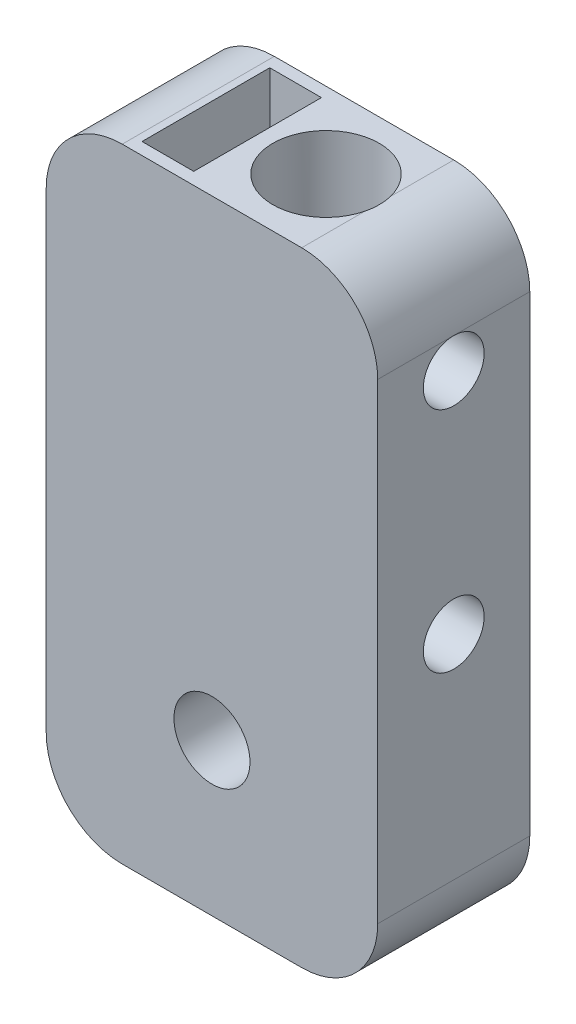
from build123d import *

# Parameters (mm, degrees)
CROQUIS1_W              = 10
CROQUIS1_H              = 41
SALIENTE_EXTRUIR1_DEPTH = 21.8
CROQUIS6_R              = 2
CORTAR_EXTRUIR2_DEPTH   = 21.8
CORTAR_EXTRUIR4_REACH   = 49.5
CROQUIS11_R             = 3.5
CROQUIS11_W             = 3.4
CROQUIS11_H             = 8.4
CORTAR_EXTRUIR5_REACH   = 49.5
CROQUIS12_R             = 2.5
REDONDEO1_R             = 5
CROQUIS13_R             = 3.5
CORTAR_EXTRUIR6_DEPTH   = 3.5
CROQUIS15_W             = 3.4
CROQUIS15_H             = 8.4
SALIENTE_EXTRUIR2_DEPTH = 13
CORTAR_EXTRUIR7_START   = -10
CROQUIS16_R             = 2.5
CORTAR_EXTRUIR7_DEPTH   = 10


with BuildPart() as part:
    # Croquis1 → Saliente-Extruir1 (new body)
    with BuildSketch(Plane(origin=(0, 0, 0), x_dir=(0, 0, -1), z_dir=(1, 0, 0))):
        with Locations((-5, -20.5)):
            Rectangle(CROQUIS1_W, CROQUIS1_H)
    extrude(amount=SALIENTE_EXTRUIR1_DEPTH)

    # Croquis6 → Cortar-Extruir2 (cut)
    with BuildSketch(Plane.ZY):
        with Locations((5, -22)):
            Circle(CROQUIS6_R)
        with Locations((5, -7)):
            Circle(CROQUIS6_R)
    extrude(amount=-CORTAR_EXTRUIR2_DEPTH, mode=Mode.SUBTRACT)

    # Croquis11 → Cortar-Extruir4 (cut, up to next)
    with BuildSketch(Plane.XZ.offset(41), mode=Mode.PRIVATE) as cortar_extruir4_sk1:
        with Locations(Location((13.4, 5, 0), (0, 0, 270))):
            Circle(CROQUIS11_R)
    cortar_extruir4_tool1 = extrude(cortar_extruir4_sk1.sketch, amount=-CORTAR_EXTRUIR4_REACH, mode=Mode.PRIVATE) & part.part
    # Croquis11 → Cortar-Extruir4 (cut, up to next)
    with BuildSketch(Plane.XZ.offset(41), mode=Mode.PRIVATE) as cortar_extruir4_sk2:
        with Locations((7.2, 5)):
            Rectangle(CROQUIS11_W, CROQUIS11_H)
    cortar_extruir4_tool2 = extrude(cortar_extruir4_sk2.sketch, amount=-CORTAR_EXTRUIR4_REACH, mode=Mode.PRIVATE) & part.part
    add(cortar_extruir4_tool1.solids().sort_by_distance((13.4, -41, 5))[0], mode=Mode.SUBTRACT)
    add(cortar_extruir4_tool2.solids().sort_by_distance((7.2, -41, 5))[0], mode=Mode.SUBTRACT)

    # Cortar-Extruir5: up to this face of the body (flat: up to its plane)
    cortar_extruir5_end = Plane(part.part.faces().sort_by_distance((10.9, -20.5, 10))[0])
    # Croquis12 → Cortar-Extruir5 (cut, up to the picked face)
    with BuildSketch(Plane(origin=(0, 0, 0), x_dir=(-1, 0, 0), z_dir=(0, 0, -1)), mode=Mode.PRIVATE) as cortar_extruir5_sk1:
        with Locations(Location((-10.9, -31, 0), (0, 0, 90))):
            Circle(CROQUIS12_R)
    cortar_extruir5_tool1 = split(extrude(cortar_extruir5_sk1.sketch, amount=-CORTAR_EXTRUIR5_REACH, mode=Mode.PRIVATE), bisect_by=cortar_extruir5_end, keep=Keep.BOTH, mode=Mode.PRIVATE)
    add(cortar_extruir5_tool1.solids().sort_by(Axis((10.9, -31, 0), (0, 0, 1)))[0], mode=Mode.SUBTRACT)

    # Redondeo1
    # the kernel refuses this fillet: 5 mm, written as the material it takes off along each edge
    with BuildSketch(Plane(origin=(21.8, -41, 22.5), x_dir=(0, 1, 0), z_dir=(0, 0, -1)), Plane(origin=(0, 0, -12.5), x_dir=(1, 0, 0), z_dir=(0, 0, 1))) as redondeo1_piece_1:
        with BuildLine():
            CenterArc((REDONDEO1_R, -REDONDEO1_R), REDONDEO1_R, 90, 90)
            Line((0, -REDONDEO1_R), (0, 0))
            Line((0, 0), (REDONDEO1_R, 0))
        make_face()
    extrude(amount=35, mode=Mode.SUBTRACT)
    with BuildSketch(Plane(origin=(21.8, 0, -12.5), x_dir=(-1, 0, 0), z_dir=(0, 0, 1)), Plane(origin=(0, -41, 22.5), x_dir=(0, 1, 0), z_dir=(0, 0, -1))) as redondeo1_piece_2:
        with BuildLine():
            CenterArc((REDONDEO1_R, REDONDEO1_R), REDONDEO1_R, 180, 90)
            Line((0, REDONDEO1_R), (0, 0))
            Line((0, 0), (REDONDEO1_R, 0))
        make_face()
    extrude(amount=35, mode=Mode.SUBTRACT)

    # Croquis13 → Cortar-Extruir6 (cut)
    with BuildSketch(Plane.ZY):
        with Locations((5, -7)):
            Circle(CROQUIS13_R)
        with Locations((5, -22)):
            Circle(CROQUIS13_R)
    extrude(amount=-CORTAR_EXTRUIR6_DEPTH, mode=Mode.SUBTRACT)

    # Croquis15 → Saliente-Extruir2 (add)
    with BuildSketch(Plane.XZ.offset(41)):
        with Locations((7.2, 5)):
            Rectangle(CROQUIS15_W, CROQUIS15_H)
        with BuildLine():
            ThreePointArc((16.8, 4.169337614), (16.9, 5), (16.8, 5.830662386))
            ThreePointArc((16.8, 5.830662386), (9.9, 5), (16.8, 4.169337614))
        make_face()
    extrude(amount=-SALIENTE_EXTRUIR2_DEPTH)

    # Croquis16 → Cortar-Extruir7 (cut)
    with BuildSketch(Plane.XY.offset(10).offset(CORTAR_EXTRUIR7_START)):
        with Locations(Location((10.9, -31, 0), (0, 0, 90))):
            Circle(CROQUIS16_R)
    extrude(amount=CORTAR_EXTRUIR7_DEPTH, mode=Mode.SUBTRACT)


solid = part.part
